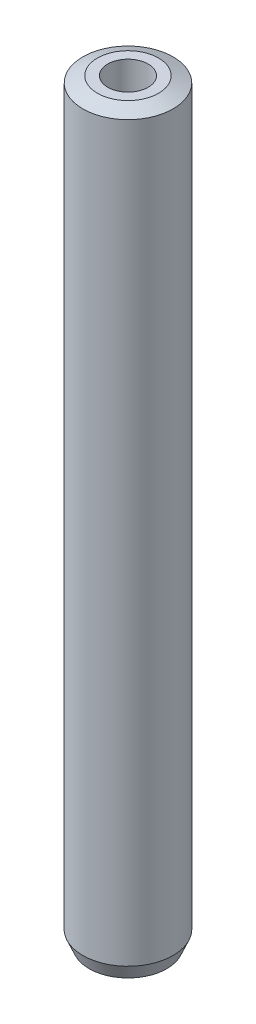
from build123d import *
from OCP.BRepFilletAPI import BRepFilletAPI_MakeChamfer

# Parameters (mm, degrees)
SKETCH1_R           = 30
BOSS_EXTRUDE1_DEPTH = 501.28639667
SKETCH2_R           = 13.435553616
CUT_EXTRUDE1_DEPTH  = 504.078573869
CHAMFER1_SIZE       = 4.14144178
CHAMFER1_SIZE2      = 9.678483386


with BuildPart() as part:
    # Sketch1 → Boss-Extrude1 (new body)
    with BuildSketch(Plane(origin=(0, 0, 0), x_dir=(1, 0, 0), z_dir=(0, 1, 0))):
        Circle(SKETCH1_R)
    extrude(amount=BOSS_EXTRUDE1_DEPTH)

    # Sketch2 → Cut-Extrude1 (cut, through all)
    with BuildSketch(Plane(origin=(0, 0, 0), x_dir=(1, 0, 0), z_dir=(0, 1, 0))):
        Circle(SKETCH2_R)
    extrude(amount=CUT_EXTRUDE1_DEPTH, mode=Mode.SUBTRACT)

    # Chamfer1: one chamfer whose edges measure the first distance from different faces: ONE call of the kernel's chamfer builder (chamfer() names one face for all edges)
    chamfer1_edges_1 = [part.edges().sort_by_distance(p)[0] for p in [
        (-30, 501.28639667, 0),
    ]]
    chamfer1_side_1 = [part.faces().sort_by_distance(p)[0] for p in [
        (-30, 250.643198335, 0),
    ]]
    chamfer1_edges_2 = [part.edges().sort_by_distance(p)[0] for p in [
        (-30, 0, 0),
    ]]
    chamfer1_side_2 = [part.faces().sort_by_distance(p)[0] for p in [
        (-29.151471863, 0, 0),
    ]]
    chamfer1 = BRepFilletAPI_MakeChamfer(part.part.solid().wrapped)
    for e in chamfer1_edges_1:
        chamfer1.Add(CHAMFER1_SIZE, CHAMFER1_SIZE2, e.wrapped, chamfer1_side_1[0].wrapped)  # the first distance lies on this face
    for e in chamfer1_edges_2:
        chamfer1.Add(CHAMFER1_SIZE, CHAMFER1_SIZE2, e.wrapped, chamfer1_side_2[0].wrapped)  # the first distance lies on this face
    add(Compound.cast(chamfer1.Shape()), mode=Mode.REPLACE)


solid = part.part
